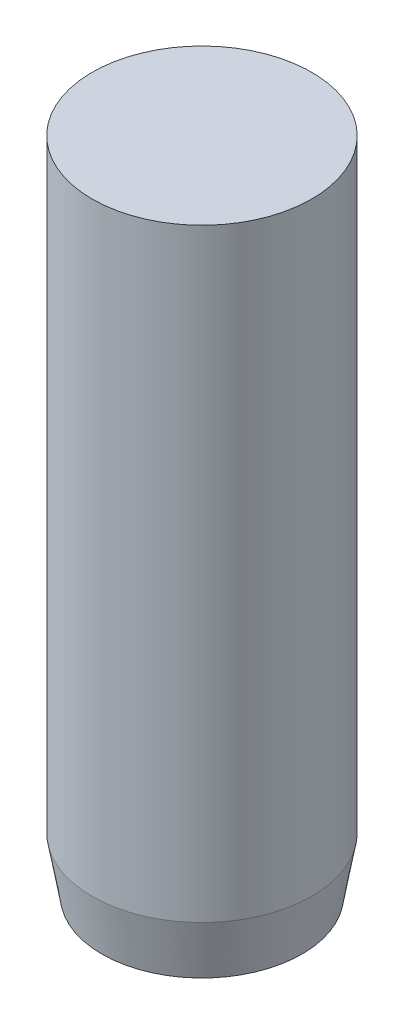
from build123d import *

# Parameters (mm, degrees)
SKETCH_1_R      = 2
EXTRUDE_1_DEPTH = 8
EXTRUDE_START   = -12
SKETCH_3_R      = 2
EXTRUDE_2_DEPTH = 12


with BuildPart() as part:
    # ｽｹｯﾁ1 → ﾎﾞｽ - 押し出し1 (new body)
    with BuildSketch(Plane(origin=(0, 0, 0), x_dir=(1, 0, 0), z_dir=(0, 1, 0))):
        Circle(SKETCH_1_R)
    extrude(amount=EXTRUDE_1_DEPTH)

    # ｽｹｯﾁ3 → ﾎﾞｽ - 押し出し2 (add)
    with BuildSketch(Plane(origin=(0, 8, 0), x_dir=(1, 0, 0), z_dir=(0, 1, 0)).offset(EXTRUDE_START)):
        Circle(SKETCH_3_R)
    extrude(amount=EXTRUDE_2_DEPTH)

    # ｽｹｯﾁ4 → ｶｯﾄ - 回転1 (revolve, cut)
    with BuildSketch(Plane(origin=(0, 0, 0), x_dir=(0, 0, -1), z_dir=(1, 0, 0))):
        Polygon((1.823673019, -4), (2, -3), (2, -4), align=None)
    revolve(axis=Axis((0, 0, 0), (0, -1, 0)), mode=Mode.SUBTRACT)


solid = part.part
